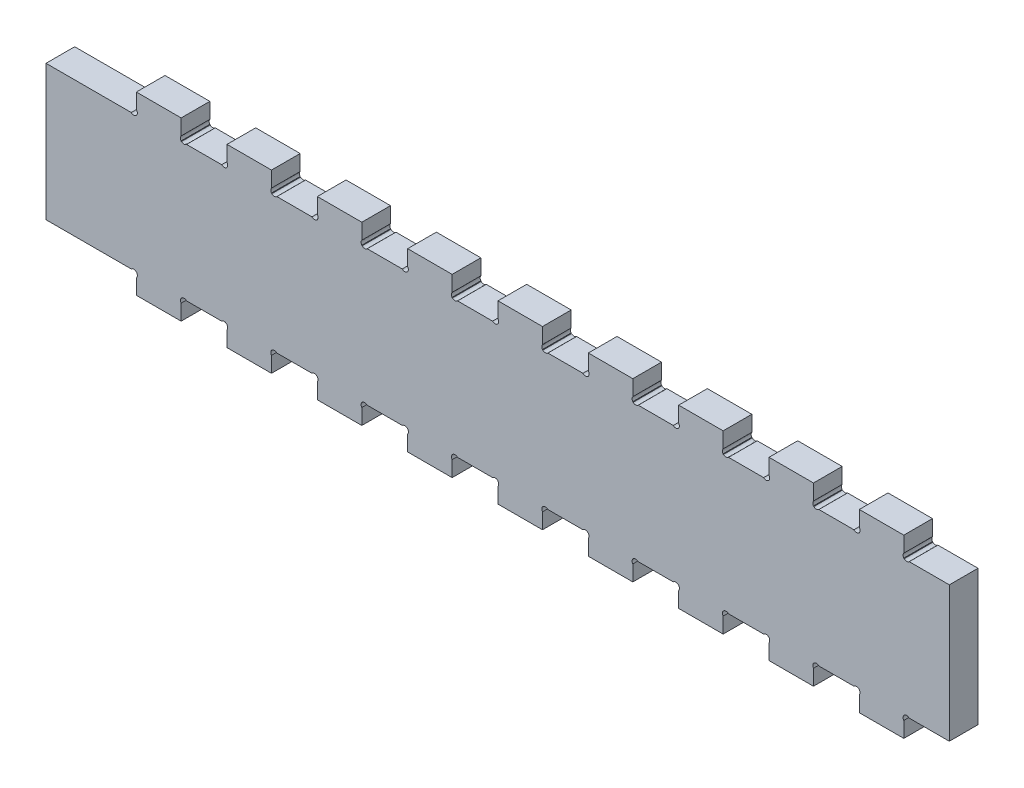
from build123d import *

# Parameters (mm, degrees)
BOSS_EXTRUDE1_DEPTH = 6.35
SKETCH2_W           = 10.1524
SKETCH2_H           = 7.304058312
SKETCH2_H_2         = 7.377109797
CUT_EXTRUDE2_DEPTH  = 204.051450213
LPATTERN1_COUNT     = 9
LPATTERN1_PITCH     = 20


# Read off the part's stored shape, not the designer's step: Boss-Extrude1
with BuildPart() as part:
    # Boss-Extrude1 outline → Boss-Extrude1 (new body)
    with BuildSketch(Plane.XY):
        with BuildLine():
            Line((190, -4.490128061), (190, -1.122532015))
            ThreePointArc((190, -1.122532015), (190, 0), (191.122532015, 0))
            Line((191.122532015, 0), (200, 0))
            Line((200, 0), (200, 30))
            Line((200, 30), (191.122532015, 30))
            ThreePointArc((191.122532015, 30), (190, 30), (190, 31.122532015))
            Line((190, 31.122532015), (190, 34.490128061))
            Line((190, 34.490128061), (180, 34.490128061))
            Line((180, 34.490128061), (180, 31.122532015))
            ThreePointArc((180, 31.122532015), (180, 30), (178.877467985, 30))
            Line((178.877467985, 30), (171.122532015, 30))
            ThreePointArc((171.122532015, 30), (170, 30), (170, 31.122532015))
            Line((170, 31.122532015), (170, 34.490128061))
            Line((170, 34.490128061), (160, 34.490128061))
            Line((160, 34.490128061), (160, 31.122532015))
            ThreePointArc((160, 31.122532015), (160, 30), (158.877467985, 30))
            Line((158.877467985, 30), (151.122532015, 30))
            ThreePointArc((151.122532015, 30), (150, 30), (150, 31.122532015))
            Line((150, 31.122532015), (150, 34.490128061))
            Line((150, 34.490128061), (140, 34.490128061))
            Line((140, 34.490128061), (140, 31.122532015))
            ThreePointArc((140, 31.122532015), (140, 30), (138.877467985, 30))
            Line((138.877467985, 30), (131.122532015, 30))
            ThreePointArc((131.122532015, 30), (130, 30), (130, 31.122532015))
            Line((130, 31.122532015), (130, 34.490128061))
            Line((130, 34.490128061), (120, 34.490128061))
            Line((120, 34.490128061), (120, 31.122532015))
            ThreePointArc((120, 31.122532015), (120, 30), (118.877467985, 30))
            Line((118.877467985, 30), (111.122532015, 30))
            ThreePointArc((111.122532015, 30), (110, 30), (110, 31.122532015))
            Line((110, 31.122532015), (110, 34.490128061))
            Line((110, 34.490128061), (100, 34.490128061))
            Line((100, 34.490128061), (100, 31.122532015))
            ThreePointArc((100, 31.122532015), (100, 30), (98.877467985, 30))
            Line((98.877467985, 30), (91.122532015, 30))
            ThreePointArc((91.122532015, 30), (90, 30), (90, 31.122532015))
            Line((90, 31.122532015), (90, 34.490128061))
            Line((90, 34.490128061), (80, 34.490128061))
            Line((80, 34.490128061), (80, 31.122532015))
            ThreePointArc((80, 31.122532015), (80, 30), (78.877467985, 30))
            Line((78.877467985, 30), (71.122532015, 30))
            ThreePointArc((71.122532015, 30), (70, 30), (70, 31.122532015))
            Line((70, 31.122532015), (70, 34.490128061))
            Line((70, 34.490128061), (60, 34.490128061))
            Line((60, 34.490128061), (60, 31.122532015))
            ThreePointArc((60, 31.122532015), (60, 30), (58.877467985, 30))
            Line((58.877467985, 30), (51.122532015, 30))
            ThreePointArc((51.122532015, 30), (50, 30), (50, 31.122532015))
            Line((50, 31.122532015), (50, 34.490128061))
            Line((50, 34.490128061), (40, 34.490128061))
            Line((40, 34.490128061), (40, 31.122532015))
            ThreePointArc((40, 31.122532015), (40, 30), (38.877467985, 30))
            Line((38.877467985, 30), (31.122532015, 30))
            ThreePointArc((31.122532015, 30), (30, 30), (30, 31.122532015))
            Line((30, 31.122532015), (30, 34.490128061))
            Line((30, 34.490128061), (20, 34.490128061))
            Line((20, 34.490128061), (20, 31.122532015))
            ThreePointArc((20, 31.122532015), (20, 30), (18.877467985, 30))
            Line((18.877467985, 30), (0, 30))
            Line((0, 30), (0, 0))
            Line((0, 0), (18.877467985, 0))
            ThreePointArc((18.877467985, 0), (20, 0), (20, -1.122532015))
            Line((20, -1.122532015), (20, -4.490128061))
            Line((20, -4.490128061), (30, -4.490128061))
            Line((30, -4.490128061), (30, -1.122532015))
            ThreePointArc((30, -1.122532015), (30, 0), (31.122532015, 0))
            Line((31.122532015, 0), (38.877467985, 0))
            ThreePointArc((38.877467985, 0), (40, 0), (40, -1.122532015))
            Line((40, -1.122532015), (40, -4.490128061))
            Line((40, -4.490128061), (50, -4.490128061))
            Line((50, -4.490128061), (50, -1.122532015))
            ThreePointArc((50, -1.122532015), (50, 0), (51.122532015, 0))
            Line((51.122532015, 0), (58.877467985, 0))
            ThreePointArc((58.877467985, 0), (60, 0), (60, -1.122532015))
            Line((60, -1.122532015), (60, -4.490128061))
            Line((60, -4.490128061), (70, -4.490128061))
            Line((70, -4.490128061), (70, -1.122532015))
            ThreePointArc((70, -1.122532015), (70, 0), (71.122532015, 0))
            Line((71.122532015, 0), (78.877467985, 0))
            ThreePointArc((78.877467985, 0), (80, 0), (80, -1.122532015))
            Line((80, -1.122532015), (80, -4.490128061))
            Line((80, -4.490128061), (90, -4.490128061))
            Line((90, -4.490128061), (90, -1.122532015))
            ThreePointArc((90, -1.122532015), (90, 0), (91.122532015, 0))
            Line((91.122532015, 0), (98.877467985, 0))
            ThreePointArc((98.877467985, 0), (100, 0), (100, -1.122532015))
            Line((100, -1.122532015), (100, -4.490128061))
            Line((100, -4.490128061), (110, -4.490128061))
            Line((110, -4.490128061), (110, -1.122532015))
            ThreePointArc((110, -1.122532015), (110, 0), (111.122532015, 0))
            Line((111.122532015, 0), (118.877467985, 0))
            ThreePointArc((118.877467985, 0), (120, 0), (120, -1.122532015))
            Line((120, -1.122532015), (120, -4.490128061))
            Line((120, -4.490128061), (130, -4.490128061))
            Line((130, -4.490128061), (130, -1.122532015))
            ThreePointArc((130, -1.122532015), (130, 0), (131.122532015, 0))
            Line((131.122532015, 0), (138.877467985, 0))
            ThreePointArc((138.877467985, 0), (140, 0), (140, -1.122532015))
            Line((140, -1.122532015), (140, -4.490128061))
            Line((140, -4.490128061), (150, -4.490128061))
            Line((150, -4.490128061), (150, -1.122532015))
            ThreePointArc((150, -1.122532015), (150, 0), (151.122532015, 0))
            Line((151.122532015, 0), (158.877467985, 0))
            ThreePointArc((158.877467985, 0), (160, 0), (160, -1.122532015))
            Line((160, -1.122532015), (160, -4.490128061))
            Line((160, -4.490128061), (170, -4.490128061))
            Line((170, -4.490128061), (170, -1.122532015))
            ThreePointArc((170, -1.122532015), (170, 0), (171.122532015, 0))
            Line((171.122532015, 0), (178.877467985, 0))
            ThreePointArc((178.877467985, 0), (180, 0), (180, -1.122532015))
            Line((180, -1.122532015), (180, -4.490128061))
            Line((180, -4.490128061), (190, -4.490128061))
        make_face()
    extrude(amount=BOSS_EXTRUDE1_DEPTH)

    # Sketch2 → Cut-Extrude2 (cut, through all)
    with BuildSketch(Plane(origin=(0, 0, 0), x_dir=(-1, 0, 0), z_dir=(0, 0, -1))):
        with Locations((-35, 33.652029156)):
            Rectangle(SKETCH2_W, SKETCH2_H)
        with Locations((-35, -3.688554899)):
            Rectangle(SKETCH2_W, SKETCH2_H_2)
    cut_extrude2 = extrude(amount=-CUT_EXTRUDE2_DEPTH, mode=Mode.SUBTRACT)

    # LPattern1: Cut-Extrude2 ×9
    with Locations(*[(i * LPATTERN1_PITCH, 0, 0) for i in range(1, LPATTERN1_COUNT)]):
        add(cut_extrude2, mode=Mode.SUBTRACT)


solid = part.part
